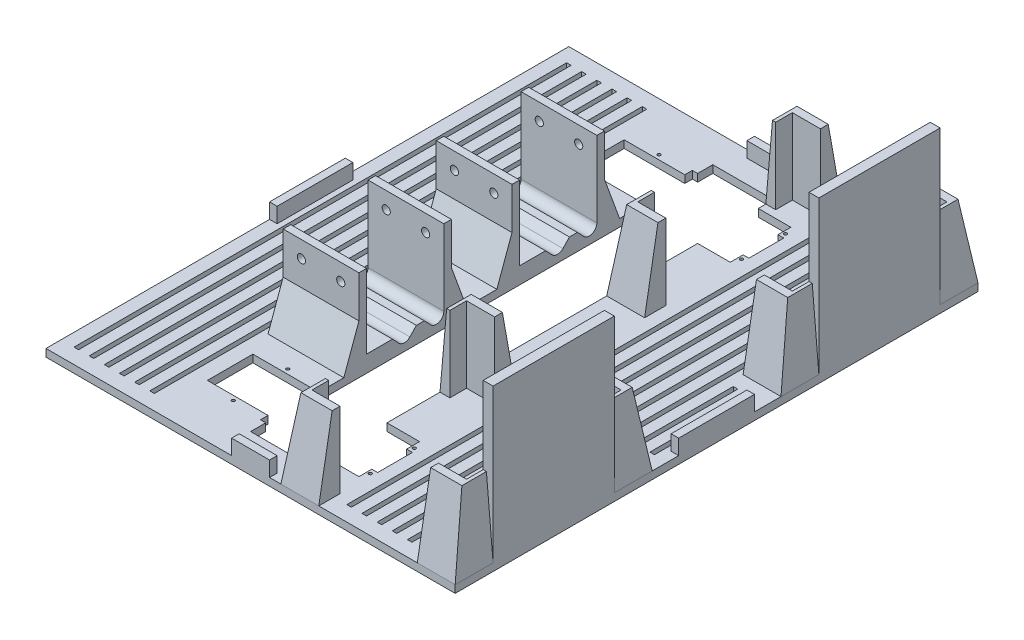
from build123d import *
from OCP.BRepFilletAPI import BRepFilletAPI_MakeChamfer

# Parameters (mm, degrees)
SKETCH1_W               = 40
SKETCH1_H               = 305
BOSS_EXTRUDE1_DEPTH     = 5
SKETCH2_W               = 50
SKETCH2_H               = 5
BOSS_EXTRUDE2_DEPTH     = 55
CHAMFER1_SIZE           = 10
CHAMFER1_SIZE2          = 27.474774195
BOSS_EXTRUDE3_DEPTH     = 50
CUT_EXTRUDE1_DEPTH      = 372.822874498
CUT_EXTRUDE1_DEPTH_BACK = 372.822874498
SKETCH3_R               = 2.7
SKETCH5_W               = 115
SKETCH5_H               = 130
SKETCH5_W_2             = 102
SKETCH5_H_2             = 102
BOSS_EXTRUDE4_DEPTH     = 50
CUT_EXTRUDE2_DEPTH      = 443.18208919
CUT_EXTRUDE2_DEPTH_BACK = 443.18208919
SKETCH6_W               = 65
SKETCH6_H               = 50
CHAMFER2_SIZE           = 8.816349035
CHAMFER2_SIZE_2         = 50
CHAMFER3_SIZE           = 50
CHAMFER3_SIZE2          = 4.374433176
SKETCH7_W               = 5
SKETCH7_H               = 50
SKETCH7_W_2             = 25
SKETCH7_H_2             = 5
BOSS_EXTRUDE5_DEPTH     = 10
SKETCH8_W               = 80
SKETCH8_H               = 50
CUT_EXTRUDE3_DEPTH      = 132
SKETCH9_R               = 1
CUT_EXTRUDE4_DEPTH      = 442.531425835
SKETCH10_W              = 3
SKETCH10_H              = 325
SKETCH10_H_2            = 82
SKETCH10_H_3            = 65
CUT_EXTRUDE_THIN1_DEPTH = 442.531425835
SKETCH11_W              = 6.5
SKETCH11_H              = 80
BOSS_EXTRUDE6_DEPTH     = 101


with BuildPart() as part:
    # Sketch1 → Boss-Extrude1 (new body)
    with BuildSketch(Plane(origin=(0, 0, 0), x_dir=(1, 0, 0), z_dir=(0, 1, 0))):
        Polygon((0, 0), (115, 0), (155, 0), (270, 0), (270, 345), (155, 345), (115, 345), (0, 345), align=None)
        with Locations((135, 172.5)):
            Rectangle(SKETCH1_W, SKETCH1_H, mode=Mode.SUBTRACT)
    extrude(amount=BOSS_EXTRUDE1_DEPTH)

    # Sketch2 → Boss-Extrude2 (add)
    with BuildSketch(Plane(origin=(0, 5, 0), x_dir=(1, 0, 0), z_dir=(0, 1, 0))):
        with Locations((90, 251)):
            Rectangle(SKETCH2_W, SKETCH2_H)
        with Locations((90, 195)):
            Rectangle(SKETCH2_W, SKETCH2_H)
        with Locations((90, 150)):
            Rectangle(SKETCH2_W, SKETCH2_H)
        with Locations((90, 94)):
            Rectangle(SKETCH2_W, SKETCH2_H)
    extrude(amount=BOSS_EXTRUDE2_DEPTH)

    # Chamfer1
    chamfer1_edges = [part.edges().sort_by_distance(p)[0] for p in [
        (90, 5, -253.5),
        (90, 5, -192.5),
        (90, 5, -152.5),
        (90, 5, -91.5),
    ]]
    chamfer1_side = [part.faces().sort_by_distance(p)[0] for p in [
        (135, 5, -4.38092456),
    ]]
    chamfer(chamfer1_edges, length=CHAMFER1_SIZE, length2=CHAMFER1_SIZE2, reference=chamfer1_side[0])

    # Sketch4 → Boss-Extrude3 (add)
    with BuildSketch(Plane(origin=(115, 0, 0), x_dir=(0, 0, -1), z_dir=(1, 0, 0))):
        with BuildLine():
            Line((96.5, 11), (96.5, 5))
            Line((96.5, 5), (121.5, 5))
            ThreePointArc((121.5, 5), (119.541666648, 5.399464109), (117.896246851, 6.534027807))
            Line((117.896246851, 6.534027807), (113.601020514, 11))
            Line((113.601020514, 11), (96.5, 11))
        make_face()
        with BuildLine():
            ThreePointArc((125.103753149, 6.534027807), (123.458333352, 5.399464109), (121.5, 5))
            Line((121.5, 5), (142.5, 5))
            ThreePointArc((142.5, 5), (140.202150936, 5.559291759), (138.418369091, 7.112044127))
            Line((138.418369091, 7.112044127), (134.601020514, 11))
            Line((134.601020514, 11), (129.398979486, 11))
            Line((129.398979486, 11), (125.103753149, 6.534027807))
        make_face()
        with BuildLine():
            ThreePointArc((147.5, 10), (146.035533906, 6.464466094), (142.5, 5))
            Line((142.5, 5), (147.5, 5))
            Line((147.5, 5), (147.5, 10))
        make_face()
        with BuildLine():
            Line((197.5, 11), (197.5, 5))
            Line((197.5, 5), (222.5, 5))
            ThreePointArc((222.5, 5), (220.541666648, 5.399464109), (218.896246851, 6.534027807))
            Line((218.896246851, 6.534027807), (214.601020514, 11))
            Line((214.601020514, 11), (197.5, 11))
        make_face()
        with BuildLine():
            ThreePointArc((226.103753149, 6.534027807), (224.458333352, 5.399464109), (222.5, 5))
            Line((222.5, 5), (243.5, 5))
            ThreePointArc((243.5, 5), (241.541666648, 5.399464109), (239.896246851, 6.534027807))
            Line((239.896246851, 6.534027807), (235.601020514, 11))
            Line((235.601020514, 11), (230.398979486, 11))
            Line((230.398979486, 11), (226.103753149, 6.534027807))
        make_face()
        with BuildLine():
            ThreePointArc((248.5, 10), (247.035533906, 6.464466094), (243.5, 5))
            Line((243.5, 5), (248.5, 5))
            Line((248.5, 5), (248.5, 10))
        make_face()
    extrude(amount=-BOSS_EXTRUDE3_DEPTH)

    # Sketch3 → Cut-Extrude1 (cut, two sides: drawn at the far end of the back side and taken through both)
    with BuildSketch(Plane.XY.offset(-248.5).offset(-CUT_EXTRUDE1_DEPTH_BACK)):
        with Locations((77, 49)):
            Circle(SKETCH3_R)
        with Locations((103, 49)):
            Circle(SKETCH3_R)
    extrude(amount=CUT_EXTRUDE1_DEPTH + CUT_EXTRUDE1_DEPTH_BACK, mode=Mode.SUBTRACT)

    # Sketch5 → Boss-Extrude4 (add)
    # profile 1 of 2: a face of its own
    with BuildSketch(Plane(origin=(0, 5, 0), x_dir=(1, 0, 0), z_dir=(0, 1, 0))):
        with Locations((212.5, 65)):
            Rectangle(SKETCH5_W, SKETCH5_H)
        with Locations((212.5, 65)):
            Rectangle(SKETCH5_W_2, SKETCH5_H_2, mode=Mode.SUBTRACT)
    # profile 2 of 2: a face of its own
    with BuildSketch(Plane(origin=(0, 5, 0), x_dir=(1, 0, 0), z_dir=(0, 1, 0))):
        with Locations((212.5, 280)):
            Rectangle(SKETCH5_W, SKETCH5_H)
        with Locations((212.5, 280)):
            Rectangle(SKETCH5_W_2, SKETCH5_H_2, mode=Mode.SUBTRACT)
    extrude(amount=BOSS_EXTRUDE4_DEPTH)

    # Sketch6 → Cut-Extrude2 (cut, two sides: drawn at the far end of the back side and taken through both)
    with BuildSketch(Plane(origin=(0, 0, -345), x_dir=(-1, 0, 0), z_dir=(0, 0, -1)).offset(-CUT_EXTRUDE2_DEPTH_BACK)):
        with Locations((-212.5, 30)):
            Rectangle(SKETCH6_W, SKETCH6_H)
    extrude(amount=CUT_EXTRUDE2_DEPTH + CUT_EXTRUDE2_DEPTH_BACK, mode=Mode.SUBTRACT)

    # Chamfer2
    chamfer2_edges_1 = [part.edges().sort_by_distance(p)[0] for p in [
        (257.5, 55, -215),
    ]]
    chamfer2_side_1 = [part.faces().sort_by_distance(p)[0] for p in [
        (257.5, 55, -215.176326981),
    ]]
    chamfer2_edges_2 = [part.edges().sort_by_distance(p)[0] for p in [
        (167.5, 55, -215),
    ]]
    chamfer2_side_2 = [part.faces().sort_by_distance(p)[0] for p in [
        (167.5, 55, -215.176326981),
    ]]
    chamfer2_edges_3 = [part.edges().sort_by_distance(p)[0] for p in [
        (167.5, 55, -345),
    ]]
    chamfer2_side_3 = [part.faces().sort_by_distance(p)[0] for p in [
        (167.5, 54.823673019, -345),
    ]]
    chamfer2_edges_4 = [part.edges().sort_by_distance(p)[0] for p in [
        (257.5, 55, -345),
    ]]
    chamfer2_side_4 = [part.faces().sort_by_distance(p)[0] for p in [
        (257.5, 54.823673019, -345),
    ]]
    chamfer2_edges_5 = [part.edges().sort_by_distance(p)[0] for p in [
        (167.5, 55, 0),
    ]]
    chamfer2_side_5 = [part.faces().sort_by_distance(p)[0] for p in [
        (167.5, 54.823673019, 0),
    ]]
    chamfer2_edges_6 = [part.edges().sort_by_distance(p)[0] for p in [
        (257.5, 55, 0),
    ]]
    chamfer2_side_6 = [part.faces().sort_by_distance(p)[0] for p in [
        (257.5, 54.823673019, 0),
    ]]
    chamfer2_edges_7 = [part.edges().sort_by_distance(p)[0] for p in [
        (257.5, 55, -130),
    ]]
    chamfer2_side_7 = [part.faces().sort_by_distance(p)[0] for p in [
        (257.5, 55, -129.823673019),
    ]]
    chamfer2_edges_8 = [part.edges().sort_by_distance(p)[0] for p in [
        (167.5, 55, -130),
    ]]
    chamfer2_side_8 = [part.faces().sort_by_distance(p)[0] for p in [
        (167.5, 55, -129.823673019),
    ]]
    chamfer2 = BRepFilletAPI_MakeChamfer(part.part.solid().wrapped)
    for e in chamfer2_edges_1:
        chamfer2.Add(CHAMFER2_SIZE - 0.0001, CHAMFER2_SIZE_2 - 0.0001, e.wrapped, chamfer2_side_1[0].wrapped)
    for e in chamfer2_edges_2:
        chamfer2.Add(CHAMFER2_SIZE - 0.0001, CHAMFER2_SIZE_2 - 0.0001, e.wrapped, chamfer2_side_2[0].wrapped)
    for e in chamfer2_edges_3:
        chamfer2.Add(CHAMFER2_SIZE_2 - 0.0001, CHAMFER2_SIZE - 0.0001, e.wrapped, chamfer2_side_3[0].wrapped)
    for e in chamfer2_edges_4:
        chamfer2.Add(CHAMFER2_SIZE_2 - 0.0001, CHAMFER2_SIZE - 0.0001, e.wrapped, chamfer2_side_4[0].wrapped)
    for e in chamfer2_edges_5:
        chamfer2.Add(CHAMFER2_SIZE_2 - 0.0001, CHAMFER2_SIZE - 0.0001, e.wrapped, chamfer2_side_5[0].wrapped)
    for e in chamfer2_edges_6:
        chamfer2.Add(CHAMFER2_SIZE_2 - 0.0001, CHAMFER2_SIZE - 0.0001, e.wrapped, chamfer2_side_6[0].wrapped)
    for e in chamfer2_edges_7:
        chamfer2.Add(CHAMFER2_SIZE - 0.0001, CHAMFER2_SIZE_2 - 0.0001, e.wrapped, chamfer2_side_7[0].wrapped)
    for e in chamfer2_edges_8:
        chamfer2.Add(CHAMFER2_SIZE - 0.0001, CHAMFER2_SIZE_2 - 0.0001, e.wrapped, chamfer2_side_8[0].wrapped)
    add(Compound.cast(chamfer2.Shape()), mode=Mode.REPLACE)  # a hair under: the kernel refuses the full size

    # Chamfer3: one chamfer whose edges measure the first distance from different faces: ONE call of the kernel's chamfer builder (chamfer() names one face for all edges)
    chamfer3_edges_1 = [part.edges().sort_by_distance(p)[0] for p in [
        (270, 55, -280),
        (270, 55, -65),
    ]]
    chamfer3_side_1 = [part.faces().sort_by_distance(p)[0] for p in [
        (270, 2.50005, -3.493565514),
    ]]
    chamfer3_edges_2 = [part.edges().sort_by_distance(p)[0] for p in [
        (155, 55, -280),
        (155, 55, -65),
    ]]
    chamfer3_side_2 = [part.faces().sort_by_distance(p)[0] for p in [
        (155, 5.00005, -341.506434486),
    ]]
    chamfer3 = BRepFilletAPI_MakeChamfer(part.part.solid().wrapped)
    for e in chamfer3_edges_1:
        chamfer3.Add(CHAMFER3_SIZE, CHAMFER3_SIZE2, e.wrapped, chamfer3_side_1[0].wrapped)  # the first distance lies on this face
    for e in chamfer3_edges_2:
        chamfer3.Add(CHAMFER3_SIZE, CHAMFER3_SIZE2, e.wrapped, chamfer3_side_2[0].wrapped)  # the first distance lies on this face
    add(Compound.cast(chamfer3.Shape()), mode=Mode.REPLACE)

    # Sketch7 → Boss-Extrude5 (add)
    with BuildSketch(Plane(origin=(0, 5, 0), x_dir=(1, 0, 0), z_dir=(0, 1, 0))):
        with Locations((267.5, 172.5)):
            Rectangle(SKETCH7_W, SKETCH7_H)
        with Locations((135, 342.5)):
            Rectangle(SKETCH7_W_2, SKETCH7_H_2)
        with Locations((2.5, 172.5)):
            Rectangle(SKETCH7_W, SKETCH7_H)
        with Locations((135, 2.5)):
            Rectangle(SKETCH7_W_2, SKETCH7_H_2)
    extrude(amount=BOSS_EXTRUDE5_DEPTH)

    # Sketch8 → Cut-Extrude3 (cut)
    with BuildSketch(Plane(origin=(270, 0, 0), x_dir=(0, 0, -1), z_dir=(1, 0, 0))):
        with Locations((65, 30)):
            Rectangle(SKETCH8_W, SKETCH8_H)
        with Locations((280, 30)):
            Rectangle(SKETCH8_W, SKETCH8_H)
    extrude(amount=-CUT_EXTRUDE3_DEPTH, mode=Mode.SUBTRACT)

    # Sketch9 → Cut-Extrude4 (cut, through all)
    with BuildSketch(Plane(origin=(0, 5, 0), x_dir=(1, 0, 0), z_dir=(0, 1, 0))):
        with Locations(Location((91.5, 68, 0), (0, 0, 270))):
            Circle(SKETCH9_R)
        with Locations(Location((91.5, 32, 0), (0, 0, 270))):
            Circle(SKETCH9_R)
        with Locations(Location((178.5, 64.5, 0), (0, 0, 270))):
            Circle(SKETCH9_R)
        with Locations(Location((178.5, 35.5, 0), (0, 0, 270))):
            Circle(SKETCH9_R)
        with Locations(Location((178.5, 309.5, 0), (0, 0, 90))):
            Circle(SKETCH9_R)
        with Locations(Location((178.5, 280.5, 0), (0, 0, 90))):
            Circle(SKETCH9_R)
        with Locations(Location((91.5, 313, 0), (0, 0, 90))):
            Circle(SKETCH9_R)
        with Locations(Location((91.5, 277, 0), (0, 0, 90))):
            Circle(SKETCH9_R)
        Polygon((111.5, 30), (176.5, 30), (176.5, 38.5), (180.321196012, 38.5), (180.321196012, 61.5), (176.5, 61.5), (176.5, 70), (111.5, 70), (111.5, 65), (71.5, 65), (71.5, 35), (111.5, 35), align=None)
        Polygon((176.5, 306.5), (176.5, 315), (111.5, 315), (111.5, 310), (71.5, 310), (71.5, 280), (111.5, 280), (111.5, 275), (176.5, 275), (176.5, 283.5), (180.321196012, 283.5), (180.321196012, 306.5), align=None)
    extrude(amount=-CUT_EXTRUDE4_DEPTH, mode=Mode.SUBTRACT)

    # Sketch10 → Cut-Extrude-Thin1 (cut, through all)
    with BuildSketch(Plane(origin=(0, 5, 0), x_dir=(1, 0, 0), z_dir=(0, 1, 0))):
        with Locations((10, 172.5)):
            Rectangle(SKETCH10_W, SKETCH10_H)
        with Locations((20, 172.5)):
            Rectangle(SKETCH10_W, SKETCH10_H)
        with Locations((30, 172.5)):
            Rectangle(SKETCH10_W, SKETCH10_H)
        with Locations((40, 172.5)):
            Rectangle(SKETCH10_W, SKETCH10_H)
        with Locations((50, 172.5)):
            Rectangle(SKETCH10_W, SKETCH10_H)
        with Locations((60, 172.5)):
            Rectangle(SKETCH10_W, SKETCH10_H)
        with Locations((240, 172.5)):
            Rectangle(SKETCH10_W, SKETCH10_H)
        with Locations((230, 172.5)):
            Rectangle(SKETCH10_W, SKETCH10_H)
        with Locations((220, 172.5)):
            Rectangle(SKETCH10_W, SKETCH10_H)
        with Locations((210, 172.5)):
            Rectangle(SKETCH10_W, SKETCH10_H)
        with Locations((200, 172.5)):
            Rectangle(SKETCH10_W, SKETCH10_H)
        with Locations((190, 172.5)):
            Rectangle(SKETCH10_W, SKETCH10_H)
        with Locations((260, 280)):
            Rectangle(SKETCH10_W, SKETCH10_H_2)
        with Locations((260, 172.5)):
            Rectangle(SKETCH10_W, SKETCH10_H_3)
        with Locations((260, 65)):
            Rectangle(SKETCH10_W, SKETCH10_H_2)
        with Locations((250, 280)):
            Rectangle(SKETCH10_W, SKETCH10_H_2)
        with Locations((250, 172.5)):
            Rectangle(SKETCH10_W, SKETCH10_H_3)
        with Locations((250, 65)):
            Rectangle(SKETCH10_W, SKETCH10_H_2)
    extrude(amount=-CUT_EXTRUDE_THIN1_DEPTH, mode=Mode.SUBTRACT)

    # Sketch11 → Boss-Extrude6 (add)
    with BuildSketch(Plane(origin=(0, 5, 0), x_dir=(1, 0, 0), z_dir=(0, 1, 0))):
        with Locations((266.75, 65)):
            Rectangle(SKETCH11_W, SKETCH11_H)
        with Locations((266.75, 280)):
            Rectangle(SKETCH11_W, SKETCH11_H)
    extrude(amount=BOSS_EXTRUDE6_DEPTH)


solid = part.part
